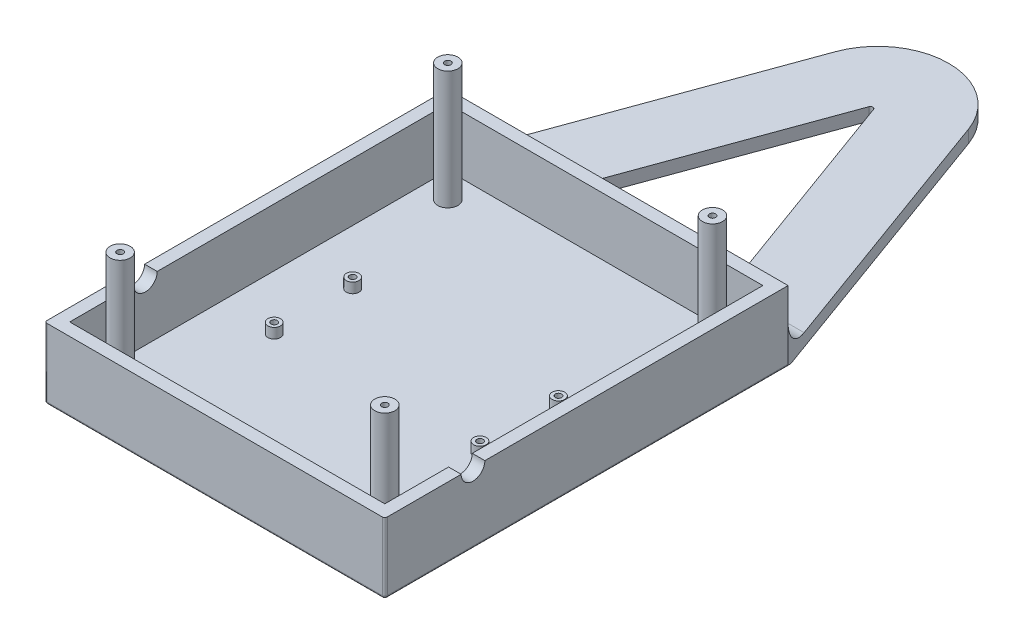
from build123d import *

# Parameters (mm, degrees)
BOSS_EXTRUDE1_DEPTH            = 5
SKETCH2_W                      = 135
SKETCH2_H                      = 160
SKETCH2_W_2                    = 125
SKETCH2_H_2                    = 150
BOSS_EXTRUDE2_DEPTH            = 23
SKETCH3_R                      = 4.7
CUT_EXTRUDE1_DEPTH             = 140
SKETCH4_R                      = 4
BOSS_EXTRUDE3_DEPTH            = 47
F_2_5MM_DOWEL_HOLE1_D          = 2.5
F_2_5MM_DOWEL_HOLE1_DEPTH      = 12
F_2_5MM_DOWEL_HOLE1_TIP        = 0.751075774
FILLET1_R                      = 1
SKETCH8_R                      = 2.5
BOSS_EXTRUDE4_DEPTH            = 4
F_2_5_2_5_DIAMETER_HOLE2_D     = 2.5
F_2_5_2_5_DIAMETER_HOLE2_DEPTH = 5
F_2_5_2_5_DIAMETER_HOLE2_TIP   = 0.751075774
FILLET2_R                      = 10


with BuildPart() as part:
    # Sketch1 → Boss-Extrude1 (new body)
    with BuildSketch(Plane(origin=(0, 0, 0), x_dir=(1, 0, 0), z_dir=(0, 1, 0))):
        with BuildLine():
            Line((-67.5, 80), (-67.5, -80))
            Line((-67.5, -80), (67.5, -80))
            Line((67.5, -80), (67.5, 80))
            Line((67.5, 80), (26.490666647, 192.672217375))
            ThreePointArc((26.490666647, 192.672217375), (0, 211.221181853), (-26.490666647, 192.672217375))
            Line((-26.490666647, 192.672217375), (-67.5, 80))
        make_face()
        Polygon((-37.5, 80), (37.5, 80), (0, 183.03040323), align=None, mode=Mode.SUBTRACT)
    extrude(amount=BOSS_EXTRUDE1_DEPTH)

    # Sketch2 → Boss-Extrude2 (add)
    with BuildSketch(Plane(origin=(0, 5, 0), x_dir=(1, 0, 0), z_dir=(0, 1, 0))):
        Rectangle(SKETCH2_W, SKETCH2_H)
        Rectangle(SKETCH2_W_2, SKETCH2_H_2, mode=Mode.SUBTRACT)
    extrude(amount=BOSS_EXTRUDE2_DEPTH)

    # Sketch3 → Cut-Extrude1 (cut)
    with BuildSketch(Plane(origin=(67.5, 0, 0), x_dir=(0, 0, -1), z_dir=(1, 0, 0))):
        with Locations((-45, 28)):
            Circle(SKETCH3_R)
    extrude(amount=-CUT_EXTRUDE1_DEPTH, mode=Mode.SUBTRACT)

    # Sketch4 → Boss-Extrude3 (add)
    with BuildSketch(Plane(origin=(0, 5, 0), x_dir=(1, 0, 0), z_dir=(0, 1, 0))):
        with Locations((-52.5, 65)):
            Circle(SKETCH4_R)
        with Locations((52.5, 65)):
            Circle(SKETCH4_R)
        with Locations((52.5, -65)):
            Circle(SKETCH4_R)
        with Locations((-52.5, -65)):
            Circle(SKETCH4_R)
    extrude(amount=BOSS_EXTRUDE3_DEPTH)

    # Ø2.5mm Dowel Hole1
    with Locations(Plane(origin=(0, 52, 0), x_dir=(1, 0, 0), z_dir=(0, 1, 0))):
        with Locations((-52.5, 65), (52.5, 65), (52.5, -65), (-52.5, -45), (-52.5, -65)):
            Hole(F_2_5MM_DOWEL_HOLE1_D / 2, depth=F_2_5MM_DOWEL_HOLE1_DEPTH)
            with Locations((0, 0, -(F_2_5MM_DOWEL_HOLE1_DEPTH + F_2_5MM_DOWEL_HOLE1_TIP / 2))):  # 118° drill point
                Cone(0, F_2_5MM_DOWEL_HOLE1_D / 2, F_2_5MM_DOWEL_HOLE1_TIP, mode=Mode.SUBTRACT)

    # Fillet1
    fillet1_edges = [part.edges().sort_by_distance(p)[0] for p in [
        (-67.5, 0, 0),
        (-67.5, 14, 80),
        (0, 0, 80),
        (67.5, 14, 80),
        (67.5, 0, 0),
        (0, 2.5, -183.03040323),
    ]]
    fillet(fillet1_edges, radius=FILLET1_R)

    # Sketch8 → Boss-Extrude4 (add)
    with BuildSketch(Plane(origin=(0, 5, 0), x_dir=(1, 0, 0), z_dir=(0, 1, 0))):
        with Locations((-40.82, 15.565)):
            Circle(SKETCH8_R)
        with Locations((-40.82, -15.565)):
            Circle(SKETCH8_R)
        with Locations((40.82, -15.565)):
            Circle(SKETCH8_R)
        with Locations((40.82, 15.565)):
            Circle(SKETCH8_R)
    extrude(amount=BOSS_EXTRUDE4_DEPTH)

    # Ø2.5 (2.5) Diameter Hole2
    with Locations(Plane(origin=(0, 9, 0), x_dir=(1, 0, 0), z_dir=(0, 1, 0))):
        with Locations((-40.82, 15.565), (-40.82, -15.565), (40.82, -15.565), (40.82, 15.565)):
            Hole(F_2_5_2_5_DIAMETER_HOLE2_D / 2, depth=F_2_5_2_5_DIAMETER_HOLE2_DEPTH)
            with Locations((0, 0, -(F_2_5_2_5_DIAMETER_HOLE2_DEPTH + F_2_5_2_5_DIAMETER_HOLE2_TIP / 2))):  # 118° drill point
                Cone(0, F_2_5_2_5_DIAMETER_HOLE2_D / 2, F_2_5_2_5_DIAMETER_HOLE2_TIP, mode=Mode.SUBTRACT)

    # Fillet2
    fillet2_edges = [part.edges().sort_by_distance(p)[0] for p in [
        (-52.5, 5, -80),
        (52.5, 5, -80),
    ]]
    fillet(fillet2_edges, radius=FILLET2_R)


solid = part.part
